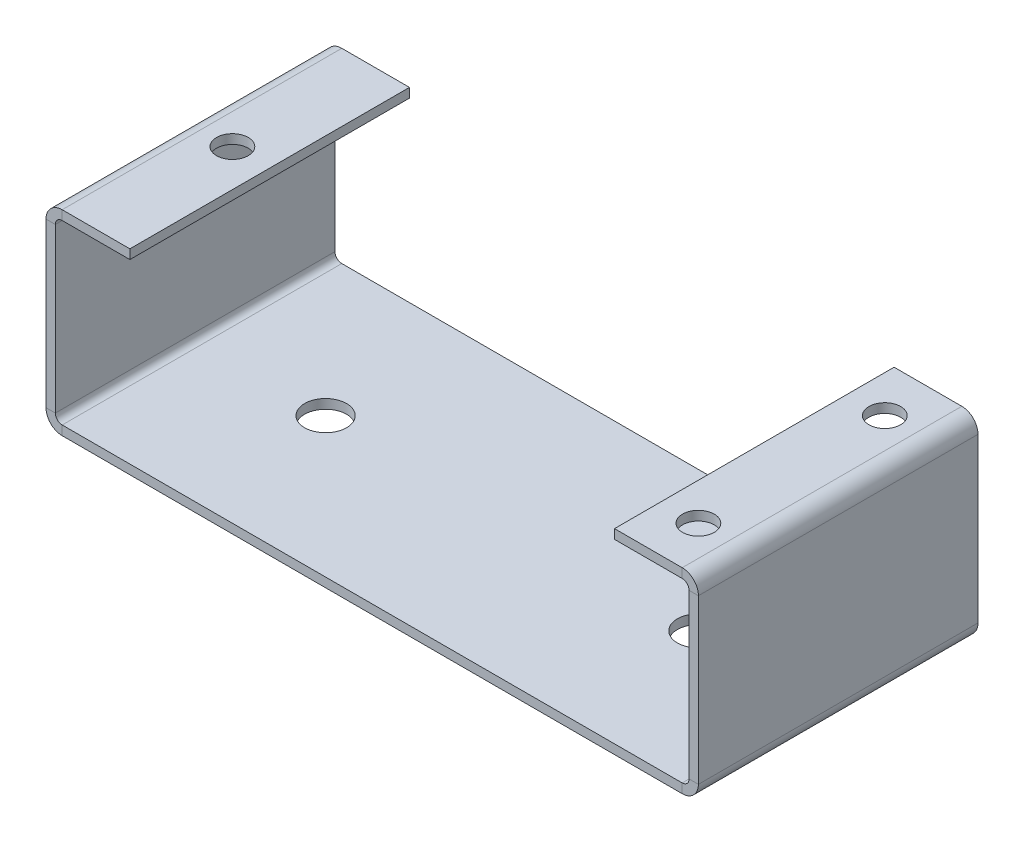
from build123d import *

# Parameters (mm, degrees)
ESQUISSE1_W                             = 70
ESQUISSE1_H                             = 30
T_LE_DE_BASE_PLI_E1_DEPTH               = 1
T_LE_PLI_E_SUR_AR_TE1_STRIP_W           = 5.4732
T_LE_PLI_E_SUR_AR_TE1_STRIP_H           = 1
T_LE_PLI_E_SUR_AR_TE1_STRIP_CUT_DEPTH   = 30
T_LE_PLI_E_SUR_AR_TE1_STRIP_2_W         = 5.4732
T_LE_PLI_E_SUR_AR_TE1_STRIP_2_H         = 1
T_LE_PLI_E_SUR_AR_TE1_STRIP_CUT_2_DEPTH = 30
T_LE_PLI_E_SUR_AR_TE1_DEPTH             = 30
T_LE_PLI_E_SUR_AR_TE1_BEND_DEPTH        = 30
T_LE_PLI_E_SUR_AR_TE2_STRIP_W           = 5.4732
T_LE_PLI_E_SUR_AR_TE2_STRIP_H           = 1
T_LE_PLI_E_SUR_AR_TE2_STRIP_CUT_DEPTH   = 30
T_LE_PLI_E_SUR_AR_TE2_STRIP_2_W         = 5.4732
T_LE_PLI_E_SUR_AR_TE2_STRIP_2_H         = 1
T_LE_PLI_E_SUR_AR_TE2_STRIP_CUT_2_DEPTH = 30
T_LE_PLI_E_SUR_AR_TE2_DEPTH             = 30
T_LE_PLI_E_SUR_AR_TE2_BEND_DEPTH        = 30
ENL_V_MAT_EXTRU_1_REACH                 = 45.486
ESQUISSE12_R                            = 1.7
ENL_V_MAT_EXTRU_3_REACH                 = 45.012
ESQUISSE27_R                            = 2.25


# Sheet-metal steps are written as plain solids
with BuildPart() as part:
    # Esquisse1 → Tôle de base pliée1 (new body)
    with BuildSketch(Plane(origin=(0, 0, 0), x_dir=(1, 0, 0), z_dir=(0, 1, 0))):
        Rectangle(ESQUISSE1_W, ESQUISSE1_H)
    extrude(amount=T_LE_DE_BASE_PLI_E1_DEPTH)

    # Tôle pliée sur arête1 strip (across the edge) → Tôle pliée sur arête1 strip cut (cut)
    with BuildSketch(Plane(origin=(-35, 1, -15), x_dir=(1, 0, 0), z_dir=(0, 0, 1))):
        with Locations((-1, -0.5)):
            Rectangle(T_LE_PLI_E_SUR_AR_TE1_STRIP_W, T_LE_PLI_E_SUR_AR_TE1_STRIP_H)
    extrude(amount=T_LE_PLI_E_SUR_AR_TE1_STRIP_CUT_DEPTH, mode=Mode.SUBTRACT)

    # Tôle pliée sur arête1 strip 2 (across the edge) → Tôle pliée sur arête1 strip cut 2 (cut)
    with BuildSketch(Plane(origin=(35, 1, 15), x_dir=(-1, 0, 0), z_dir=(0, 0, -1))):
        with Locations((-1, -0.5)):
            Rectangle(T_LE_PLI_E_SUR_AR_TE1_STRIP_2_W, T_LE_PLI_E_SUR_AR_TE1_STRIP_2_H)
    extrude(amount=T_LE_PLI_E_SUR_AR_TE1_STRIP_CUT_2_DEPTH, mode=Mode.SUBTRACT)

    # Tôle pliée sur arête1 section (across the edge) → Tôle pliée sur arête1 (add)
    with BuildSketch(Plane(origin=(-35, 1, -15), x_dir=(1, 0, 0), z_dir=(0, 0, 1))):
        with BuildLine():
            Line((0, 0.7366), (0, 20))
            Line((0, 20), (1, 20))
            Line((1, 20), (1, 0.7366))
            ThreePointArc((1, 0.7366), (1.215745145, 0.215745145), (1.7366, 0))
            Line((1.7366, 0), (1.7366, -1))
            ThreePointArc((1.7366, -1), (0.508638364, -0.491361636), (0, 0.7366))
        make_face()
    extrude(amount=T_LE_PLI_E_SUR_AR_TE1_DEPTH)

    # Tôle pliée sur arête1 section 2 (across the edge) → Tôle pliée sur arête1 bend (add)
    with BuildSketch(Plane(origin=(35, 1, 15), x_dir=(-1, 0, 0), z_dir=(0, 0, -1))):
        with BuildLine():
            Line((0, 0.7366), (0, 20))
            Line((0, 20), (1, 20))
            Line((1, 20), (1, 0.7366))
            ThreePointArc((1, 0.7366), (1.215745145, 0.215745145), (1.7366, 0))
            Line((1.7366, 0), (1.7366, -1))
            ThreePointArc((1.7366, -1), (0.508638364, -0.491361636), (0, 0.7366))
        make_face()
    extrude(amount=T_LE_PLI_E_SUR_AR_TE1_BEND_DEPTH)

    # Tôle pliée sur arête2 strip (across the edge) → Tôle pliée sur arête2 strip cut (cut)
    with BuildSketch(Plane(origin=(-34, 21, -15), x_dir=(0, -1, 0), z_dir=(0, 0, 1))):
        with Locations((-1, -0.5)):
            Rectangle(T_LE_PLI_E_SUR_AR_TE2_STRIP_W, T_LE_PLI_E_SUR_AR_TE2_STRIP_H)
    extrude(amount=T_LE_PLI_E_SUR_AR_TE2_STRIP_CUT_DEPTH, mode=Mode.SUBTRACT)

    # Tôle pliée sur arête2 strip 2 (across the edge) → Tôle pliée sur arête2 strip cut 2 (cut)
    with BuildSketch(Plane(origin=(34, 21, 15), x_dir=(0, -1, 0), z_dir=(0, 0, -1))):
        with Locations((-1, -0.5)):
            Rectangle(T_LE_PLI_E_SUR_AR_TE2_STRIP_2_W, T_LE_PLI_E_SUR_AR_TE2_STRIP_2_H)
    extrude(amount=T_LE_PLI_E_SUR_AR_TE2_STRIP_CUT_2_DEPTH, mode=Mode.SUBTRACT)

    # Tôle pliée sur arête2 section (across the edge) → Tôle pliée sur arête2 (add)
    with BuildSketch(Plane(origin=(-34, 21, -15), x_dir=(0, -1, 0), z_dir=(0, 0, 1))):
        with BuildLine():
            Line((0, 0.7366), (0, 8))
            Line((0, 8), (1, 8))
            Line((1, 8), (1, 0.7366))
            ThreePointArc((1, 0.7366), (1.215745145, 0.215745145), (1.7366, 0))
            Line((1.7366, 0), (1.7366, -1))
            ThreePointArc((1.7366, -1), (0.508638364, -0.491361636), (0, 0.7366))
        make_face()
    extrude(amount=T_LE_PLI_E_SUR_AR_TE2_DEPTH)

    # Tôle pliée sur arête2 section 2 (across the edge) → Tôle pliée sur arête2 bend (add)
    with BuildSketch(Plane(origin=(34, 21, 15), x_dir=(0, -1, 0), z_dir=(0, 0, -1))):
        with BuildLine():
            Line((0, 0.7366), (0, 8))
            Line((0, 8), (1, 8))
            Line((1, 8), (1, 0.7366))
            ThreePointArc((1, 0.7366), (1.215745145, 0.215745145), (1.7366, 0))
            Line((1.7366, 0), (1.7366, -1))
            ThreePointArc((1.7366, -1), (0.508638364, -0.491361636), (0, 0.7366))
        make_face()
    extrude(amount=T_LE_PLI_E_SUR_AR_TE2_BEND_DEPTH)

    # Esquisse12 → Enlèv. mat.-Extru.1 (cut, up to next)
    with BuildSketch(Plane(origin=(0, 21, 0), x_dir=(1, 0, 0), z_dir=(0, 1, 0)), mode=Mode.PRIVATE) as enl_v_mat_extru_1_sk1:
        with Locations(Location((-30, 0, 0), (0, 0, 180))):
            Circle(ESQUISSE12_R)
    enl_v_mat_extru_1_tool1 = extrude(enl_v_mat_extru_1_sk1.sketch, amount=-ENL_V_MAT_EXTRU_1_REACH, mode=Mode.PRIVATE) & part.part
    # Esquisse12 → Enlèv. mat.-Extru.1 (cut, up to next)
    with BuildSketch(Plane(origin=(0, 21, 0), x_dir=(1, 0, 0), z_dir=(0, 1, 0)), mode=Mode.PRIVATE) as enl_v_mat_extru_1_sk2:
        with Locations(Location((30, 10, 0), (0, 0, 180))):
            Circle(ESQUISSE12_R)
    enl_v_mat_extru_1_tool2 = extrude(enl_v_mat_extru_1_sk2.sketch, amount=-ENL_V_MAT_EXTRU_1_REACH, mode=Mode.PRIVATE) & part.part
    # Esquisse12 → Enlèv. mat.-Extru.1 (cut, up to next)
    with BuildSketch(Plane(origin=(0, 21, 0), x_dir=(1, 0, 0), z_dir=(0, 1, 0)), mode=Mode.PRIVATE) as enl_v_mat_extru_1_sk3:
        with Locations(Location((30, -10, 0), (0, 0, 180))):
            Circle(ESQUISSE12_R)
    enl_v_mat_extru_1_tool3 = extrude(enl_v_mat_extru_1_sk3.sketch, amount=-ENL_V_MAT_EXTRU_1_REACH, mode=Mode.PRIVATE) & part.part
    add(enl_v_mat_extru_1_tool1.solids().sort_by_distance((-30, 21, 0))[0], mode=Mode.SUBTRACT)
    add(enl_v_mat_extru_1_tool2.solids().sort_by_distance((30, 21, -10))[0], mode=Mode.SUBTRACT)
    add(enl_v_mat_extru_1_tool3.solids().sort_by_distance((30, 21, 10))[0], mode=Mode.SUBTRACT)

    # Esquisse27 → Enlèv. mat.-Extru.3 (cut, up to next)
    with BuildSketch(Plane(origin=(0, 1, 0), x_dir=(1, 0, 0), z_dir=(0, 1, 0)), mode=Mode.PRIVATE) as enl_v_mat_extru_3_sk1:
        with Locations(Location((-20, 0, 0), (0, 0, 270))):
            Circle(ESQUISSE27_R)
    enl_v_mat_extru_3_tool1 = extrude(enl_v_mat_extru_3_sk1.sketch, amount=-ENL_V_MAT_EXTRU_3_REACH, mode=Mode.PRIVATE) & part.part
    # Esquisse27 → Enlèv. mat.-Extru.3 (cut, up to next)
    with BuildSketch(Plane(origin=(0, 1, 0), x_dir=(1, 0, 0), z_dir=(0, 1, 0)), mode=Mode.PRIVATE) as enl_v_mat_extru_3_sk2:
        with Locations(Location((20, 0, 0), (0, 0, 90))):
            Circle(ESQUISSE27_R)
    enl_v_mat_extru_3_tool2 = extrude(enl_v_mat_extru_3_sk2.sketch, amount=-ENL_V_MAT_EXTRU_3_REACH, mode=Mode.PRIVATE) & part.part
    add(enl_v_mat_extru_3_tool1.solids().sort_by_distance((-20, 1, 0))[0], mode=Mode.SUBTRACT)
    add(enl_v_mat_extru_3_tool2.solids().sort_by_distance((20, 1, 0))[0], mode=Mode.SUBTRACT)


solid = part.part
